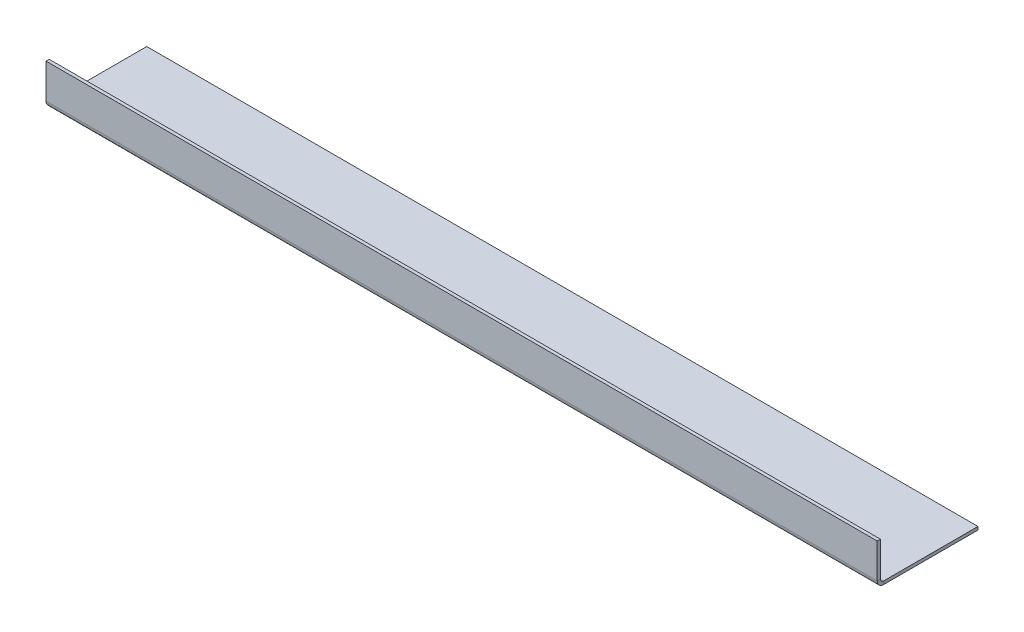
from build123d import *

# Parameters (mm, degrees)
SKETCH1_W                    = 838.2
SKETCH1_H                    = 101.6
BASE_FLANGE1_DEPTH           = 3.175
EDGE_FLANGE1_STRIP_W         = 19.05
EDGE_FLANGE1_STRIP_H         = 3.175
EDGE_FLANGE1_STRIP_CUT_DEPTH = 838.2
EDGE_FLANGE1_DEPTH           = 838.2


# Sheet-metal steps are written as plain solids
with BuildPart() as part:
    # Sketch1 → Base-Flange1 (new body)
    with BuildSketch(Plane(origin=(0, 0, 0), x_dir=(1, 0, 0), z_dir=(0, 1, 0))):
        with Locations((419.1, 50.8)):
            Rectangle(SKETCH1_W, SKETCH1_H)
    extrude(amount=-BASE_FLANGE1_DEPTH)

    # Edge-Flange1 strip (across the edge) → Edge-Flange1 strip cut (cut)
    with BuildSketch(Plane(origin=(0, 0, 0), x_dir=(0, 0, -1), z_dir=(1, 0, 0))):
        with Locations((-3.175, -1.5875)):
            Rectangle(EDGE_FLANGE1_STRIP_W, EDGE_FLANGE1_STRIP_H)
    extrude(amount=EDGE_FLANGE1_STRIP_CUT_DEPTH, mode=Mode.SUBTRACT)

    # Edge-Flange1 section (across the edge) → Edge-Flange1 (add)
    with BuildSketch(Plane(origin=(0, 0, 0), x_dir=(0, 0, -1), z_dir=(1, 0, 0))):
        with BuildLine():
            Line((0, 3.175), (0, 38.1))
            Line((0, 38.1), (3.175, 38.1))
            Line((3.175, 38.1), (3.175, 3.175))
            ThreePointArc((3.175, 3.175), (4.10493597, 0.92993597), (6.35, 0))
            Line((6.35, 0), (6.35, -3.175))
            ThreePointArc((6.35, -3.175), (1.859871939, -1.315128061), (0, 3.175))
        make_face()
    extrude(amount=EDGE_FLANGE1_DEPTH)


solid = part.part
